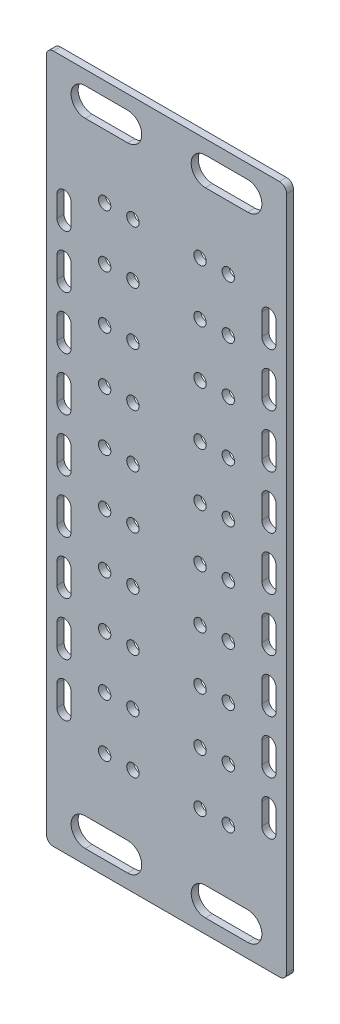
from build123d import *

# Parameters (mm, degrees)
ESBO_O1_W             = 68
ESBO_O1_H             = 195
FLANGE_BASE1_DEPTH    = 2
FILETE1_R             = 2
ESBO_O2_R             = 1.75
CORTE_EXTRUS_O1_DEPTH = 10


# Sheet-metal steps are written as plain solids
with BuildPart() as part:
    # Esboço1 → Flange-base1 (new body)
    with BuildSketch(Plane.XY):
        with Locations((34, 97.5)):
            Rectangle(ESBO_O1_W, ESBO_O1_H)
    extrude(amount=-FLANGE_BASE1_DEPTH)

    # Filete1
    filete1_edges = [part.edges().sort_by_distance(p)[0] for p in [
        (0, 195, -1),
        (68, 195, -1),
        (68, 0, -1),
        (0, 0, -1),
    ]]
    fillet(filete1_edges, radius=FILETE1_R)

    # Esboço2 → Corte-extrusão1 (cut)
    with BuildSketch(Plane.XY):
        with Locations((16.5, 165)):
            Circle(ESBO_O2_R)
        with Locations((24.5, 165)):
            Circle(ESBO_O2_R)
        with Locations((43.5, 165)):
            Circle(ESBO_O2_R)
        with Locations((51.5, 165)):
            Circle(ESBO_O2_R)
        with Locations((43.5, 150)):
            Circle(ESBO_O2_R)
        with Locations((51.5, 150)):
            Circle(ESBO_O2_R)
        with Locations((43.5, 135)):
            Circle(ESBO_O2_R)
        with Locations((51.5, 135)):
            Circle(ESBO_O2_R)
        with Locations((43.5, 120)):
            Circle(ESBO_O2_R)
        with Locations((51.5, 120)):
            Circle(ESBO_O2_R)
        with Locations((43.5, 105)):
            Circle(ESBO_O2_R)
        with Locations((51.5, 105)):
            Circle(ESBO_O2_R)
        with Locations((16.5, 150)):
            Circle(ESBO_O2_R)
        with Locations((24.5, 150)):
            Circle(ESBO_O2_R)
        with Locations((16.5, 135)):
            Circle(ESBO_O2_R)
        with Locations((24.5, 135)):
            Circle(ESBO_O2_R)
        with Locations((16.5, 120)):
            Circle(ESBO_O2_R)
        with Locations((24.5, 120)):
            Circle(ESBO_O2_R)
        with Locations((16.5, 105)):
            Circle(ESBO_O2_R)
        with Locations((24.5, 105)):
            Circle(ESBO_O2_R)
        with Locations((16.5, 90)):
            Circle(ESBO_O2_R)
        with Locations((24.5, 90)):
            Circle(ESBO_O2_R)
        with Locations((43.5, 90)):
            Circle(ESBO_O2_R)
        with Locations((51.5, 90)):
            Circle(ESBO_O2_R)
        with Locations((16.5, 75)):
            Circle(ESBO_O2_R)
        with Locations((24.5, 75)):
            Circle(ESBO_O2_R)
        with Locations((43.5, 75)):
            Circle(ESBO_O2_R)
        with Locations((51.5, 75)):
            Circle(ESBO_O2_R)
        with Locations((16.5, 60)):
            Circle(ESBO_O2_R)
        with Locations((24.5, 60)):
            Circle(ESBO_O2_R)
        with Locations((43.5, 60)):
            Circle(ESBO_O2_R)
        with Locations((51.5, 60)):
            Circle(ESBO_O2_R)
        with Locations((16.5, 45)):
            Circle(ESBO_O2_R)
        with Locations((24.5, 45)):
            Circle(ESBO_O2_R)
        with Locations((43.5, 45)):
            Circle(ESBO_O2_R)
        with Locations((51.5, 45)):
            Circle(ESBO_O2_R)
        with Locations((16.5, 30)):
            Circle(ESBO_O2_R)
        with Locations((24.5, 30)):
            Circle(ESBO_O2_R)
        with Locations((43.5, 30)):
            Circle(ESBO_O2_R)
        with Locations((51.5, 30)):
            Circle(ESBO_O2_R)
        with BuildLine():
            Line((11, 191), (23, 191))
            ThreePointArc((23, 191), (27, 187), (23, 183))
            Line((23, 183), (11, 183))
            ThreePointArc((11, 183), (7, 187), (11, 191))
        make_face()
        with BuildLine():
            Line((57, 191), (45, 191))
            ThreePointArc((45, 191), (41, 187), (45, 183))
            Line((45, 183), (57, 183))
            ThreePointArc((57, 183), (61, 187), (57, 191))
        make_face()
        with BuildLine():
            Line((11, 4), (23, 4))
            ThreePointArc((23, 4), (27, 8), (23, 12))
            Line((23, 12), (11, 12))
            ThreePointArc((11, 12), (7, 8), (11, 4))
        make_face()
        with BuildLine():
            Line((57, 4), (45, 4))
            ThreePointArc((45, 4), (41, 8), (45, 12))
            Line((45, 12), (57, 12))
            ThreePointArc((57, 12), (61, 8), (57, 4))
        make_face()
        with BuildLine():
            Line((7, 160.5), (7, 154.5))
            ThreePointArc((7, 154.5), (5, 152.5), (3, 154.5))
            Line((3, 154.5), (3, 160.5))
            ThreePointArc((3, 160.5), (5, 162.5), (7, 160.5))
        make_face()
        with BuildLine():
            Line((65, 160.5), (65, 154.5))
            ThreePointArc((65, 154.5), (63, 152.5), (61, 154.5))
            Line((61, 154.5), (61, 160.5))
            ThreePointArc((61, 160.5), (63, 162.5), (65, 160.5))
        make_face()
        with BuildLine():
            Line((65, 145.5), (65, 139.5))
            ThreePointArc((65, 139.5), (63, 137.5), (61, 139.5))
            Line((61, 139.5), (61, 145.5))
            ThreePointArc((61, 145.5), (63, 147.5), (65, 145.5))
        make_face()
        with BuildLine():
            Line((65, 130.5), (65, 124.5))
            ThreePointArc((65, 124.5), (63, 122.5), (61, 124.5))
            Line((61, 124.5), (61, 130.5))
            ThreePointArc((61, 130.5), (63, 132.5), (65, 130.5))
        make_face()
        with BuildLine():
            Line((65, 115.5), (65, 109.5))
            ThreePointArc((65, 109.5), (63, 107.5), (61, 109.5))
            Line((61, 109.5), (61, 115.5))
            ThreePointArc((61, 115.5), (63, 117.5), (65, 115.5))
        make_face()
        with BuildLine():
            Line((65, 100.5), (65, 94.5))
            ThreePointArc((65, 94.5), (63, 92.5), (61, 94.5))
            Line((61, 94.5), (61, 100.5))
            ThreePointArc((61, 100.5), (63, 102.5), (65, 100.5))
        make_face()
        with BuildLine():
            Line((65, 85.5), (65, 79.5))
            ThreePointArc((65, 79.5), (63, 77.5), (61, 79.5))
            Line((61, 79.5), (61, 85.5))
            ThreePointArc((61, 85.5), (63, 87.5), (65, 85.5))
        make_face()
        with BuildLine():
            Line((65, 70.5), (65, 64.5))
            ThreePointArc((65, 64.5), (63, 62.5), (61, 64.5))
            Line((61, 64.5), (61, 70.5))
            ThreePointArc((61, 70.5), (63, 72.5), (65, 70.5))
        make_face()
        with BuildLine():
            Line((65, 55.5), (65, 49.5))
            ThreePointArc((65, 49.5), (63, 47.5), (61, 49.5))
            Line((61, 49.5), (61, 55.5))
            ThreePointArc((61, 55.5), (63, 57.5), (65, 55.5))
        make_face()
        with BuildLine():
            Line((7, 145.5), (7, 139.5))
            ThreePointArc((7, 139.5), (5, 137.5), (3, 139.5))
            Line((3, 139.5), (3, 145.5))
            ThreePointArc((3, 145.5), (5, 147.5), (7, 145.5))
        make_face()
        with BuildLine():
            Line((7, 130.5), (7, 124.5))
            ThreePointArc((7, 124.5), (5, 122.5), (3, 124.5))
            Line((3, 124.5), (3, 130.5))
            ThreePointArc((3, 130.5), (5, 132.5), (7, 130.5))
        make_face()
        with BuildLine():
            Line((7, 115.5), (7, 109.5))
            ThreePointArc((7, 109.5), (5, 107.5), (3, 109.5))
            Line((3, 109.5), (3, 115.5))
            ThreePointArc((3, 115.5), (5, 117.5), (7, 115.5))
        make_face()
        with BuildLine():
            Line((7, 100.5), (7, 94.5))
            ThreePointArc((7, 94.5), (5, 92.5), (3, 94.5))
            Line((3, 94.5), (3, 100.5))
            ThreePointArc((3, 100.5), (5, 102.5), (7, 100.5))
        make_face()
        with BuildLine():
            Line((7, 85.5), (7, 79.5))
            ThreePointArc((7, 79.5), (5, 77.5), (3, 79.5))
            Line((3, 79.5), (3, 85.5))
            ThreePointArc((3, 85.5), (5, 87.5), (7, 85.5))
        make_face()
        with BuildLine():
            Line((7, 70.5), (7, 64.5))
            ThreePointArc((7, 64.5), (5, 62.5), (3, 64.5))
            Line((3, 64.5), (3, 70.5))
            ThreePointArc((3, 70.5), (5, 72.5), (7, 70.5))
        make_face()
        with BuildLine():
            Line((7, 55.5), (7, 49.5))
            ThreePointArc((7, 49.5), (5, 47.5), (3, 49.5))
            Line((3, 49.5), (3, 55.5))
            ThreePointArc((3, 55.5), (5, 57.5), (7, 55.5))
        make_face()
        with BuildLine():
            Line((7, 40.5), (7, 34.5))
            ThreePointArc((7, 34.5), (5, 32.5), (3, 34.5))
            Line((3, 34.5), (3, 40.5))
            ThreePointArc((3, 40.5), (5, 42.5), (7, 40.5))
        make_face()
        with BuildLine():
            Line((65, 40.5), (65, 34.5))
            ThreePointArc((65, 34.5), (63, 32.5), (61, 34.5))
            Line((61, 34.5), (61, 40.5))
            ThreePointArc((61, 40.5), (63, 42.5), (65, 40.5))
        make_face()
    extrude(amount=-CORTE_EXTRUS_O1_DEPTH, mode=Mode.SUBTRACT)


solid = part.part
